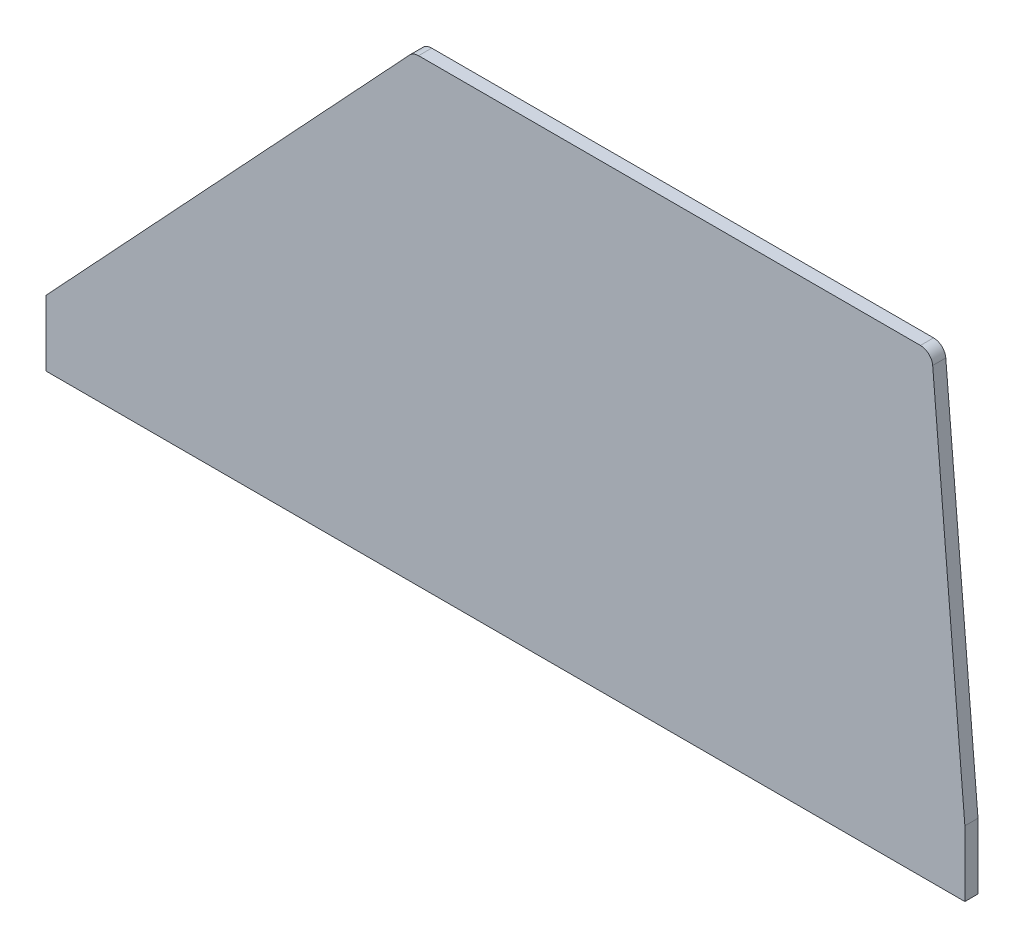
from build123d import *

# Parameters (mm, degrees)
BOSS_EXTRUDE3_DEPTH = 2.54
FILLET2_R           = 4.7625


with BuildPart() as part:
    # Sketch1 → Boss-Extrude3 (new, symmetric)
    with BuildSketch(Plane.XY):
        Polygon((0, 0), (142.113, 152.397534488), (342.773, 152.397534488), (355.6, -0.002465512), (355.6, -25.4), (0, -25.4), align=None)
    extrude(amount=BOSS_EXTRUDE3_DEPTH, both=True)

    # Fillet2
    fillet2_edges = [part.edges().sort_by_distance(p)[0] for p in [
        (342.773, 152.397534488, 0),
        (142.113, 152.397534488, 0),
    ]]
    fillet(fillet2_edges, radius=FILLET2_R)


solid = part.part
